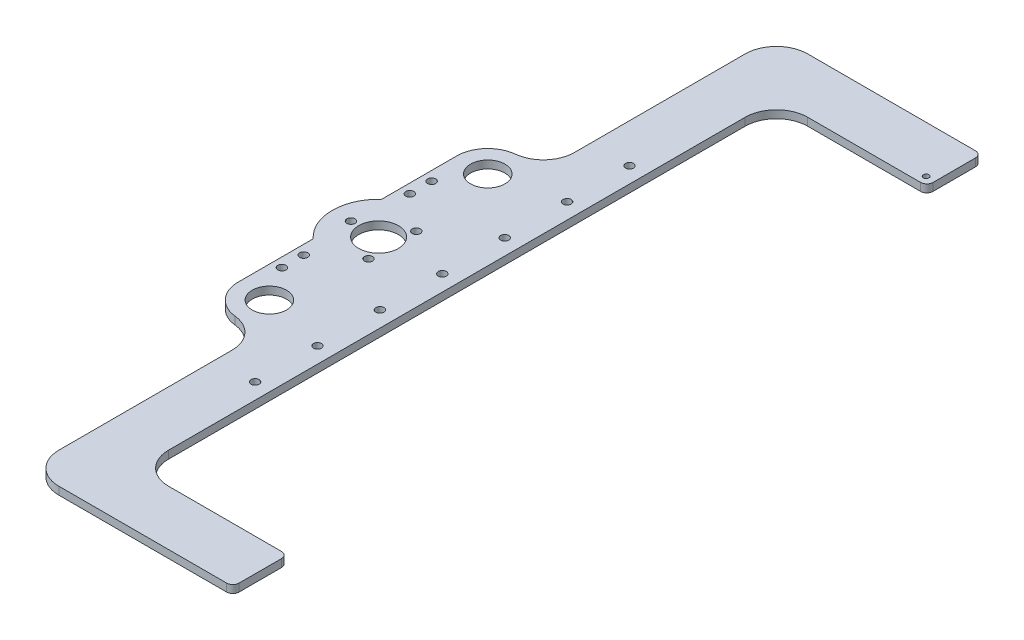
from build123d import *

# Parameters (mm, degrees)
SKETCH1_R           = 1.143
SKETCH1_R_2         = 6.985
SKETCH1_R_3         = 1.6499967
SKETCH1_R_4         = 8.0645
BOSS_EXTRUDE1_DEPTH = 3.175
FILLET1_R           = 2.54


with BuildPart() as part:
    # Sketch1 → Boss-Extrude1 (new body)
    with BuildSketch(Plane(origin=(0, 0, 0), x_dir=(1, 0, 0), z_dir=(0, 1, 0))):
        with BuildLine():
            Line((-67.971311517, -52.728298572), (-67.971311517, -82.586411585))
            ThreePointArc((-67.971311517, -82.586411585), (-64.941959488, -91.499608698), (-56.608448003, -95.878494725))
            ThreePointArc((-56.608448003, -95.878494725), (-48.492989851, -100.008926653), (-45.228378476, -108.509717293))
            Line((-45.228378476, -108.509717293), (-45.228378476, -114.997272158))
            Line((-45.228378476, -114.997272158), (-45.228378476, -128.204620988))
            Line((-45.228378476, -128.204620988), (-45.228378476, -179.004620988))
            ThreePointArc((-45.228378476, -179.004620988), (-41.508634597, -187.984877109), (-32.528378476, -191.704620988))
            Line((-32.528378476, -191.704620988), (-22.903517531, -191.704620988))
            Line((-22.903517531, -191.704620988), (38.310482469, -191.704620988))
            Line((38.310482469, -191.704620988), (38.310482469, -169.379760042))
            Line((38.310482469, -169.379760042), (-10.203517531, -169.379760042))
            ThreePointArc((-10.203517531, -169.379760042), (-19.183773652, -165.660016163), (-22.903517531, -156.679760042))
            Line((-22.903517531, -156.679760042), (-22.903517531, -128.204620988))
            Line((-22.903517531, -128.204620988), (-22.903517531, 49.595379012))
            Line((-22.903517531, 49.595379012), (-22.903517531, 78.070518067))
            ThreePointArc((-22.903517531, 78.070518067), (-19.183773652, 87.050774188), (-10.203517531, 90.770518067))
            Line((-10.203517531, 90.770518067), (38.310482469, 90.770518067))
            Line((38.310482469, 90.770518067), (38.310482469, 113.095379012))
            Line((38.310482469, 113.095379012), (-22.903517531, 113.095379012))
            Line((-22.903517531, 113.095379012), (-32.528378476, 113.095379012))
            ThreePointArc((-32.528378476, 113.095379012), (-41.508634597, 109.375635133), (-45.228378476, 100.395379012))
            Line((-45.228378476, 100.395379012), (-45.228378476, 49.595379012))
            Line((-45.228378476, 49.595379012), (-45.228378476, 37.402727842))
            Line((-45.228378476, 37.402727842), (-45.228378476, 30.915172977))
            ThreePointArc((-45.228378476, 30.915172977), (-48.492989851, 22.414382337), (-56.608448003, 18.28395041))
            ThreePointArc((-56.608448003, 18.28395041), (-64.941959488, 13.905064383), (-67.971311517, 4.991867269))
            Line((-67.971311517, 4.991867269), (-67.971311517, -24.866245744))
            ThreePointArc((-67.971311517, -24.866245744), (-74.128017531, -38.797272158), (-67.971311517, -52.728298572))
        make_face()
        with Locations((34.754482469, 94.072518067)):
            Circle(SKETCH1_R, mode=Mode.SUBTRACT)
        with Locations((-55.288517531, -83.247272158)):
            Circle(SKETCH1_R_2, mode=Mode.SUBTRACT)
        with Locations((-64.161311517, -69.277272158)):
            Circle(SKETCH1_R_3, mode=Mode.SUBTRACT)
        with Locations((-64.161311517, -60.387272158)):
            Circle(SKETCH1_R_3, mode=Mode.SUBTRACT)
        with Locations((-55.288517531, -38.797272158)):
            Circle(SKETCH1_R_4, mode=Mode.SUBTRACT)
        with Locations((-49.668767531, -29.063579632)):
            Circle(SKETCH1_R_3, mode=Mode.SUBTRACT)
        with Locations((-49.668767531, -48.530964684)):
            Circle(SKETCH1_R_3, mode=Mode.SUBTRACT)
        with Locations((-66.528017531, -38.797272158)):
            Circle(SKETCH1_R_3, mode=Mode.SUBTRACT)
        with Locations((-64.161311517, -17.207272158)):
            Circle(SKETCH1_R_3, mode=Mode.SUBTRACT)
        with Locations((-64.161311517, -8.317272158)):
            Circle(SKETCH1_R_3, mode=Mode.SUBTRACT)
        with Locations((-55.288517531, 5.652727842)):
            Circle(SKETCH1_R_2, mode=Mode.SUBTRACT)
        with Locations((-29.342032123, 37.402727842)):
            Circle(SKETCH1_R_3, mode=Mode.SUBTRACT)
        with Locations((-29.342032123, 12.002727842)):
            Circle(SKETCH1_R_3, mode=Mode.SUBTRACT)
        with Locations((-29.342032123, -13.397272158)):
            Circle(SKETCH1_R_3, mode=Mode.SUBTRACT)
        with Locations((-29.342032123, -38.797272158)):
            Circle(SKETCH1_R_3, mode=Mode.SUBTRACT)
        with Locations((-29.342032123, -64.197272158)):
            Circle(SKETCH1_R_3, mode=Mode.SUBTRACT)
        with Locations((-29.342032123, -89.597272158)):
            Circle(SKETCH1_R_3, mode=Mode.SUBTRACT)
        with Locations((-29.342032123, -114.997272158)):
            Circle(SKETCH1_R_3, mode=Mode.SUBTRACT)
    extrude(amount=BOSS_EXTRUDE1_DEPTH)

    # Fillet1
    fillet1_edges = [part.edges().sort_by_distance(p)[0] for p in [
        (38.310482469, 1.5875, -113.095379012),
        (38.310482469, 1.5875, -90.770518067),
        (38.310482469, 1.5875, 169.379760042),
        (38.310482469, 1.5875, 191.704620988),
    ]]
    fillet(fillet1_edges, radius=FILLET1_R)


solid = part.part
